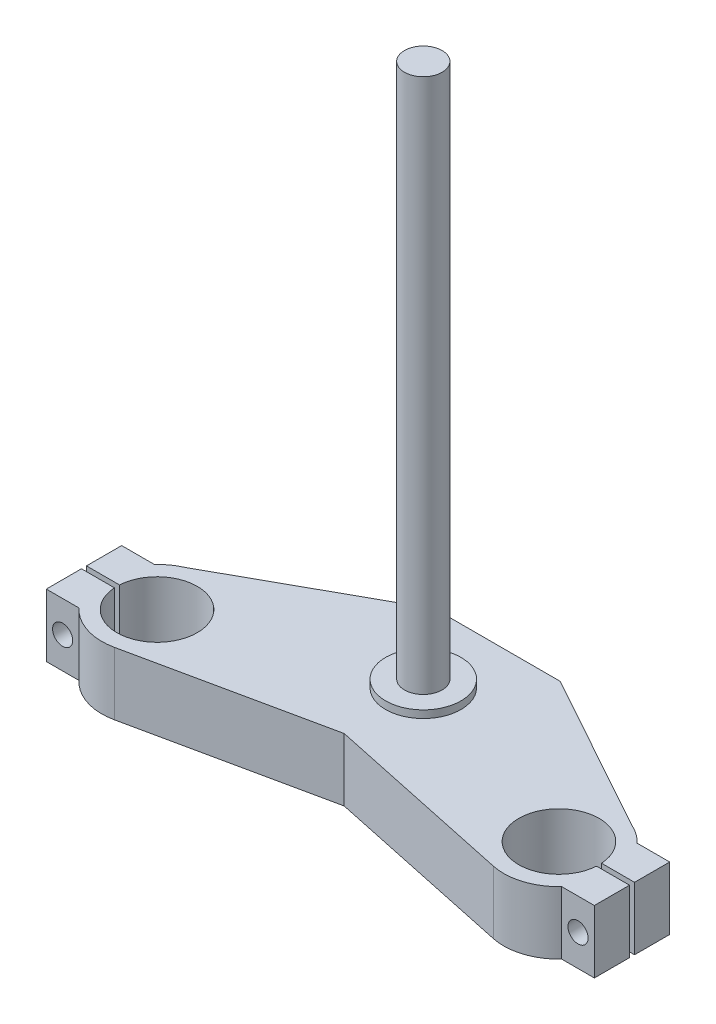
from build123d import *

# Parameters (mm, degrees)
BOSS_EXTRUDE1_DEPTH = 25
SKETCH3_R           = 4
CUT_EXTRUDE1_DEPTH  = 15
SKETCH4_R           = 15
BOSS_EXTRUDE2_DEPTH = 3
SKETCH5_R           = 7.5
BOSS_EXTRUDE3_DEPTH = 213


with BuildPart() as part:
    # Sketch1 → Boss-Extrude1 (new body)
    with BuildSketch(Plane(origin=(0, 0, 0), x_dir=(1, 0, 0), z_dir=(0, 1, 0))):
        with BuildLine():
            Line((-25, 55.5), (-88.782047704, 20.180509757))
            ThreePointArc((-88.782047704, 20.180509757), (-92.710355788, 17.967308971), (-96.105195929, 15))
            Line((-96.105195929, 15), (-109.105195929, 15))
            Line((-109.105195929, 15), (-109.105195929, 1))
            Line((-109.105195929, 1), (-95.968719423, 1))
            ThreePointArc((-95.968719423, 1), (-64, 0), (-95.968719423, -1))
            Line((-95.968719423, -1), (-109.105195929, -1))
            Line((-109.105195929, -1), (-109.105195929, -15))
            Line((-109.105195929, -15), (-96.105195929, -15))
            ThreePointArc((-96.105195929, -15), (-86.625068957, -20.987753506), (-75.425325161, -21.527881597))
            Line((-75.425325161, -21.527881597), (0, -5.5))
            Line((0, -5.5), (75.425325161, -21.527881597))
            ThreePointArc((75.425325161, -21.527881597), (86.625068957, -20.987753506), (96.105195929, -15))
            Line((96.105195929, -15), (109.105195929, -15))
            Line((109.105195929, -15), (109.105195929, -1))
            Line((109.105195929, -1), (95.968719423, -1))
            ThreePointArc((95.968719423, -1), (64, 0), (95.968719423, 1))
            Line((95.968719423, 1), (109.105195929, 1))
            Line((109.105195929, 1), (109.105195929, 15))
            Line((109.105195929, 15), (96.105195929, 15))
            ThreePointArc((96.105195929, 15), (92.710355788, 17.967308971), (88.782047704, 20.180509757))
            Line((88.782047704, 20.180509757), (25, 55.5))
            Line((25, 55.5), (1, 55.5))
            Line((1, 55.5), (-1, 55.5))
            Line((-1, 55.5), (-25, 55.5))
        make_face()
    extrude(amount=BOSS_EXTRUDE1_DEPTH)

    # Sketch3 → Cut-Extrude1 (cut, symmetric)
    with BuildSketch(Plane.XY):
        with Locations((-102.605195929, 12.5)):
            Circle(SKETCH3_R)
        with Locations((102.605195929, 12.5)):
            Circle(SKETCH3_R)
    extrude(amount=CUT_EXTRUDE1_DEPTH, both=True, mode=Mode.SUBTRACT)

    # Sketch4 → Boss-Extrude2 (add)
    with BuildSketch(Plane(origin=(0, 25, 0), x_dir=(1, 0, 0), z_dir=(0, 1, 0))):
        with Locations((0, 26)):
            Circle(SKETCH4_R)
    extrude(amount=BOSS_EXTRUDE2_DEPTH)

    # Sketch5 → Boss-Extrude3 (add)
    with BuildSketch(Plane(origin=(0, 28, 0), x_dir=(1, 0, 0), z_dir=(0, 1, 0))):
        with Locations((0, 26)):
            Circle(SKETCH5_R)
    extrude(amount=BOSS_EXTRUDE3_DEPTH)


solid = part.part
